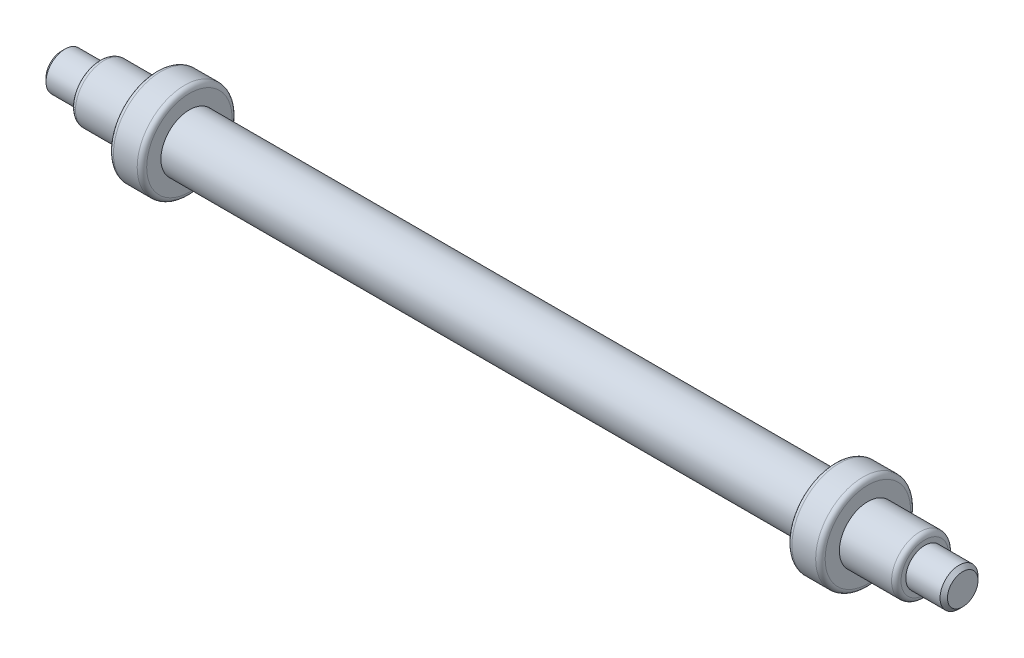
from build123d import *

# Parameters (mm, degrees)
SKETCH2_W = 3.5
SKETCH2_H = 2
FILLET1_R = 0.5
FILLET2_R = 0.5
FILLET3_R = 0.5


# Read off the part's stored shape, not the designer's step: M4x0.7 Machine Threads Stud1, M4x0.7 Machine Threads Stud2
with BuildPart() as part:
    # Sketch1 → Revolve1 (revolve)
    with BuildSketch(Plane.XY, mode=Mode.PRIVATE) as revolve1_sk:
        Polygon((47.5, 0), (47.5, 2), (43.5, 2), (43.5, 3), (-43.5, 3), (-43.5, 2), (-47.5, 2), (-47.5, 0), align=None)
    revolve(revolve1_sk.sketch.rotate(Axis((-51.987746382, 0, 0), (1, 0, 0)), 90), axis=Axis((-51.987746382, 0, 0), (1, 0, 0)))

    # M4x0.7 Machine Threads Stud1 outline → M4x0.7 Machine Threads Stud1 (revolve, cut)
    with BuildSketch(Plane.YX):
        Polygon((2, 47.5), (1.61, 47.5), (2, 47.11), align=None)
    revolve(axis=Axis((0, 0, 0), (1, 0, 0)), mode=Mode.SUBTRACT)

    # M4x0.7 Machine Threads Stud2 outline → M4x0.7 Machine Threads Stud2 (revolve, cut)
    with BuildSketch(Plane.YX):
        Polygon((2, -47.11), (1.61, -47.5), (2, -47.5), align=None)
    revolve(axis=Axis((0, 0, 0), (1, 0, 0)), mode=Mode.SUBTRACT)

    # Fillet3
    fillet3_edges = [part.edges().sort_by_distance(p)[0] for p in [
        (-43.5, 0, -3),
        (43.5, 0, -3),
    ]]
    fillet(fillet3_edges, radius=FILLET3_R)


with BuildPart() as body_2:
    # Sketch2 → Revolve2 (revolve)
    with BuildSketch(Plane.XY, mode=Mode.PRIVATE) as revolve2_sk:
        with Locations((-35.75, 4)):
            Rectangle(SKETCH2_W, SKETCH2_H)
        with Locations((35.75, 4)):
            Rectangle(SKETCH2_W, SKETCH2_H)
    revolve(revolve2_sk.sketch.rotate(Axis((-51.987746382, 0, 0), (1, 0, 0)), 90), axis=Axis((-51.987746382, 0, 0), (1, 0, 0)))

    # Fillet1
    fillet1_edges = [body_2.edges().sort_by_distance(p)[0] for p in [
        (-34, 0, -5),
        (-37.5, 0, -5),
    ]]
    fillet(fillet1_edges, radius=FILLET1_R)

    # Fillet2
    fillet2_edges = [body_2.edges().sort_by_distance(p)[0] for p in [
        (37.5, 0, -5),
        (34, 0, -5),
    ]]
    fillet(fillet2_edges, radius=FILLET2_R)


solid = Compound([part.part, body_2.part])
